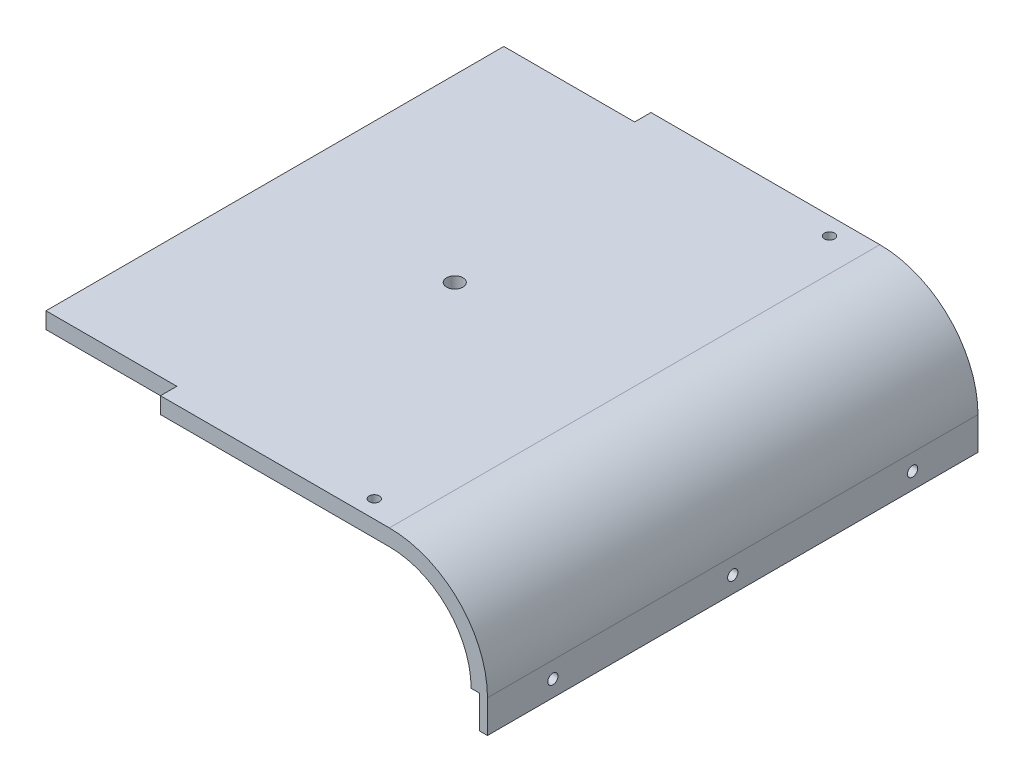
from build123d import *

# Parameters (mm, degrees)
BOSS_EXTRUDE1_DEPTH      = 190.5
BOSS_EXTRUDE1_DEPTH_BACK = 190.5
SKETCH2_W                = 6.35
SKETCH2_H                = 381
BOSS_EXTRUDE2_DEPTH      = 25.4
SKETCH3_R                = 3.96875
CUT_EXTRUDE1_DEPTH       = 25.4
SKETCH4_R                = 6.35
CUT_EXTRUDE2_DEPTH       = 17.78
SKETCH5_R                = 3.937
CUT_EXTRUDE3_DEPTH       = 306.328708116


with BuildPart() as part:
    # Sketch1 → Boss-Extrude1 (new, two sides: drawn at the far end of the back side and taken through both)
    with BuildSketch(Plane.XY.offset(-BOSS_EXTRUDE1_DEPTH_BACK)):
        with BuildLine():
            Line((-139.7, 0), (139.7, 0))
            ThreePointArc((139.7, 0), (193.581536726, -22.318463274), (215.9, -76.2))
            Line((215.9, -76.2), (203.2, -76.2))
            ThreePointArc((203.2, -76.2), (184.601280605, -31.298719395), (139.7, -12.7))
            Line((139.7, -12.7), (-139.7, -12.7))
            Line((-139.7, -12.7), (-139.7, 0))
        make_face()
    extrude(amount=BOSS_EXTRUDE1_DEPTH + BOSS_EXTRUDE1_DEPTH_BACK)

    # Sketch2 → Boss-Extrude2 (add)
    with BuildSketch(Plane.XZ.offset(76.2)):
        with Locations((212.725, 0)):
            Rectangle(SKETCH2_W, SKETCH2_H)
    extrude(amount=BOSS_EXTRUDE2_DEPTH)

    # Sketch3 → Cut-Extrude1 (cut)
    with BuildSketch(Plane(origin=(215.9, 0, 0), x_dir=(0, 0, -1), z_dir=(1, 0, 0))):
        with Locations((-139.7, -88.9)):
            Circle(SKETCH3_R)
        with Locations((0, -88.9)):
            Circle(SKETCH3_R)
        with Locations((139.7, -88.9)):
            Circle(SKETCH3_R)
    extrude(amount=-CUT_EXTRUDE1_DEPTH, mode=Mode.SUBTRACT)

    # Sketch4 → Cut-Extrude2 (cut)
    with BuildSketch(Plane(origin=(0, 0, 0), x_dir=(1, 0, 0), z_dir=(0, 1, 0))):
        Circle(SKETCH4_R)
    extrude(amount=-CUT_EXTRUDE2_DEPTH, mode=Mode.SUBTRACT)

    # Sketch5 → Cut-Extrude3 (cut, through all)
    with BuildSketch(Plane(origin=(0, 0, 0), x_dir=(1, 0, 0), z_dir=(0, 1, 0))):
        with Locations((114.3, -176.784)):
            Circle(SKETCH5_R)
        with Locations((114.3, 176.784)):
            Circle(SKETCH5_R)
        Polygon((-114.3, -177.8), (-139.7, -177.8), (-139.7, -190.5), (-38.1, -190.5), (-38.1, -177.8), align=None)
        Polygon((-38.1, 190.5), (-38.1, 177.8), (-114.3, 177.8), (-139.7, 177.8), (-139.7, 190.5), align=None)
    extrude(amount=-CUT_EXTRUDE3_DEPTH, mode=Mode.SUBTRACT)


solid = part.part
